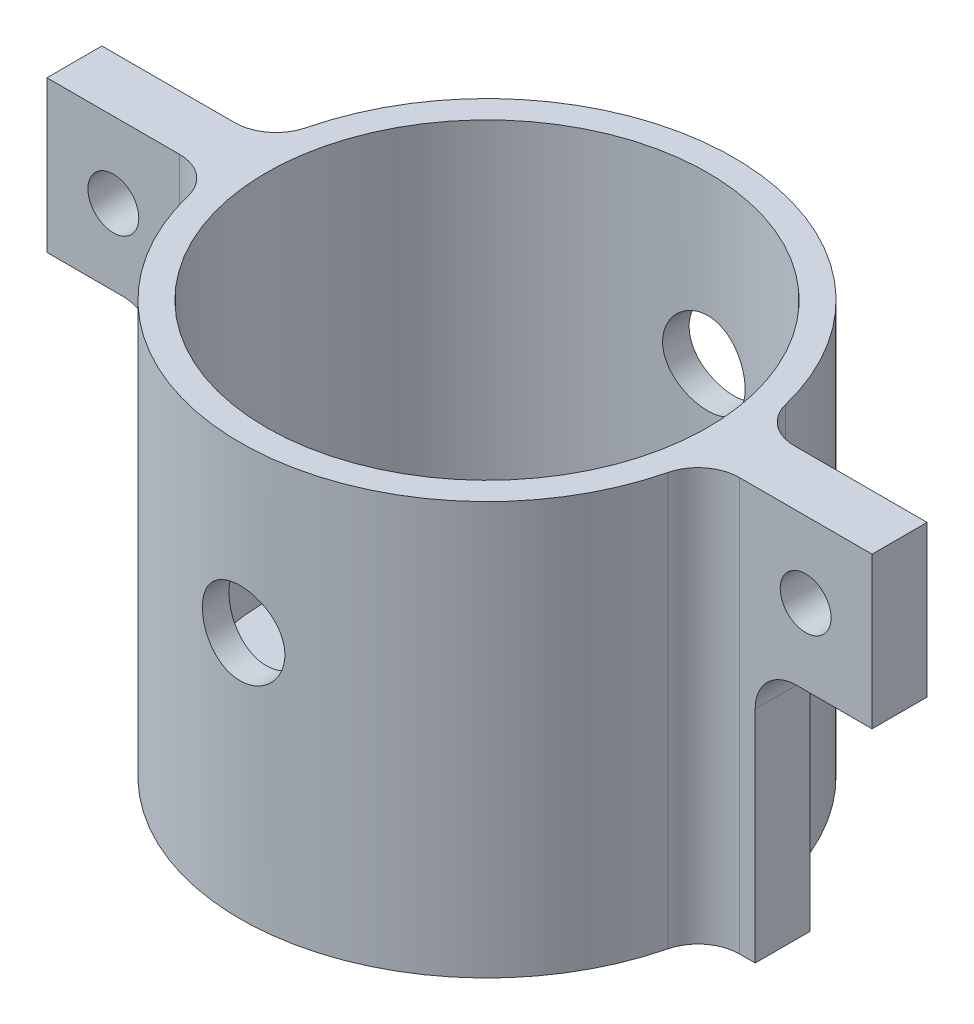
from build123d import *

# Parameters (mm, degrees)
BOSS_EXTRUDE1_DEPTH = 30
SKETCH4_W           = 4
SKETCH4_H           = 19
CUT_EXTRUDE3_DEPTH  = 8.5
SKETCH7_R           = 16.05
CUT_EXTRUDE4_DEPTH  = 27
SKETCH6_R           = 9
CUT_EXTRUDE5_DEPTH  = 4
FILLET3_R           = 3
FILLET4_R           = 3
SKETCH8_R           = 1.85
CUT_EXTRUDE6_DEPTH  = 4
SKETCH9_R           = 3
CUT_EXTRUDE7_DEPTH  = 37


with BuildPart() as part:
    # Sketch1 → Boss-Extrude1 (new body)
    with BuildSketch(Plane(origin=(0, 0, 0), x_dir=(1, 0, 0), z_dir=(0, 1, 0))):
        with BuildLine():
            Line((-30, -2), (-30, 2))
            Line((-30, 2), (-17.838231415, 2))
            ThreePointArc((-17.838231415, 2), (0, 17.95), (17.838231415, 2))
            Line((17.838231415, 2), (30, 2))
            Line((30, 2), (30, -2))
            Line((30, -2), (17.838231415, -2))
            ThreePointArc((17.838231415, -2), (0, -17.95), (-17.838231415, -2))
            Line((-17.838231415, -2), (-30, -2))
        make_face()
    extrude(amount=BOSS_EXTRUDE1_DEPTH)

    # Sketch4 → Cut-Extrude3 (cut)
    with BuildSketch(Plane.ZY.offset(30)):
        with Locations((0, 9.5)):
            Rectangle(SKETCH4_W, SKETCH4_H)
    cut_extrude3 = extrude(amount=-CUT_EXTRUDE3_DEPTH, mode=Mode.SUBTRACT)

    # Mirror1: Cut-Extrude3 across plane
    add(cut_extrude3.mirror(Plane(origin=(0, 0, 0), x_dir=(0, 0, 1), z_dir=(1, 0, 0))), mode=Mode.SUBTRACT)

    # Sketch7 → Cut-Extrude4 (cut)
    with BuildSketch(Plane(origin=(0, 30, 0), x_dir=(1, 0, 0), z_dir=(0, 1, 0))):
        Circle(SKETCH7_R)
    extrude(amount=-CUT_EXTRUDE4_DEPTH, mode=Mode.SUBTRACT)

    # Sketch6 → Cut-Extrude5 (cut)
    with BuildSketch(Plane.XZ):
        Circle(SKETCH6_R)
    extrude(amount=-CUT_EXTRUDE5_DEPTH, mode=Mode.SUBTRACT)

    # Fillet3
    fillet3_edges = [part.edges().sort_by_distance(p)[0] for p in [
        (17.838231415, 15, 2),
        (17.838231415, 15, -2),
        (-17.838231415, 15, 2),
        (-17.838231415, 15, -2),
    ]]
    fillet(fillet3_edges, radius=FILLET3_R)

    # Fillet4
    fillet4_edges = [part.edges().sort_by_distance(p)[0] for p in [
        (-21.5, 19, 0),
        (21.5, 19, 0),
    ]]
    fillet(fillet4_edges, radius=FILLET4_R)

    # Sketch8 → Cut-Extrude6 (cut)
    with BuildSketch(Plane(origin=(0, 0, -2), x_dir=(-1, 0, 0), z_dir=(0, 0, -1))):
        with Locations((-25.17, 24.5)):
            Circle(SKETCH8_R)
        with Locations((25.17, 24.5)):
            Circle(SKETCH8_R)
    extrude(amount=-CUT_EXTRUDE6_DEPTH, mode=Mode.SUBTRACT)

    # Sketch9 → Cut-Extrude7 (cut)
    with BuildSketch(Plane(origin=(0, 0, -17.95), x_dir=(-1, 0, 0), z_dir=(0, 0, -1))):
        with Locations((0, 18)):
            Circle(SKETCH9_R)
    extrude(amount=-CUT_EXTRUDE7_DEPTH, mode=Mode.SUBTRACT)


solid = part.part
